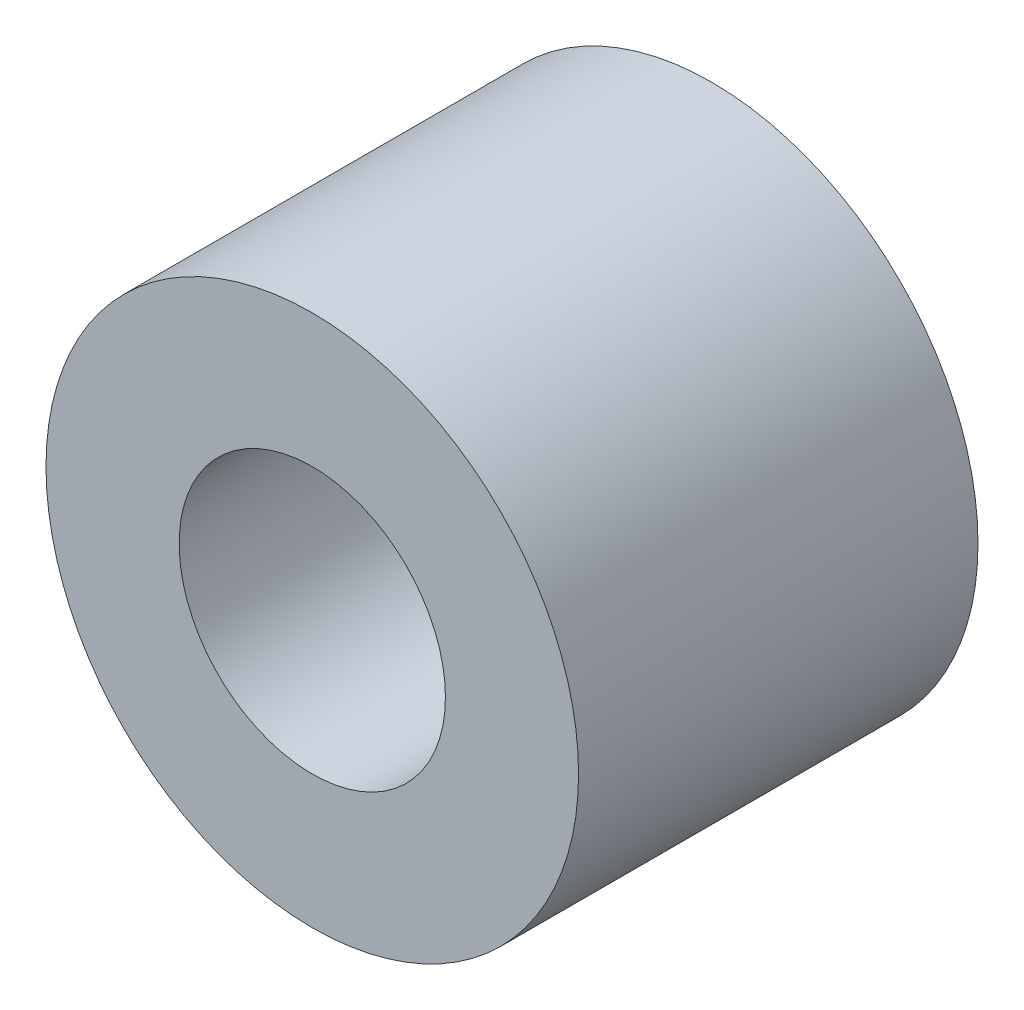
from build123d import *

# Parameters (mm, degrees)
RESSALTO_EXTRUS_O1_DEPTH      = 15
RESSALTO_EXTRUS_O1_DEPTH_BACK = 15
ESBO_O1_R                     = 20
ESBO_O1_R_2                   = 10


with BuildPart() as part:
    # Esboço1 → Ressalto-extrusão1 (new, two sides: drawn at the far end of the back side and taken through both)
    with BuildSketch(Plane.XY.offset(-RESSALTO_EXTRUS_O1_DEPTH_BACK)):
        Circle(ESBO_O1_R)
        Circle(ESBO_O1_R_2, mode=Mode.SUBTRACT)
    extrude(amount=RESSALTO_EXTRUS_O1_DEPTH + RESSALTO_EXTRUS_O1_DEPTH_BACK)


solid = part.part
